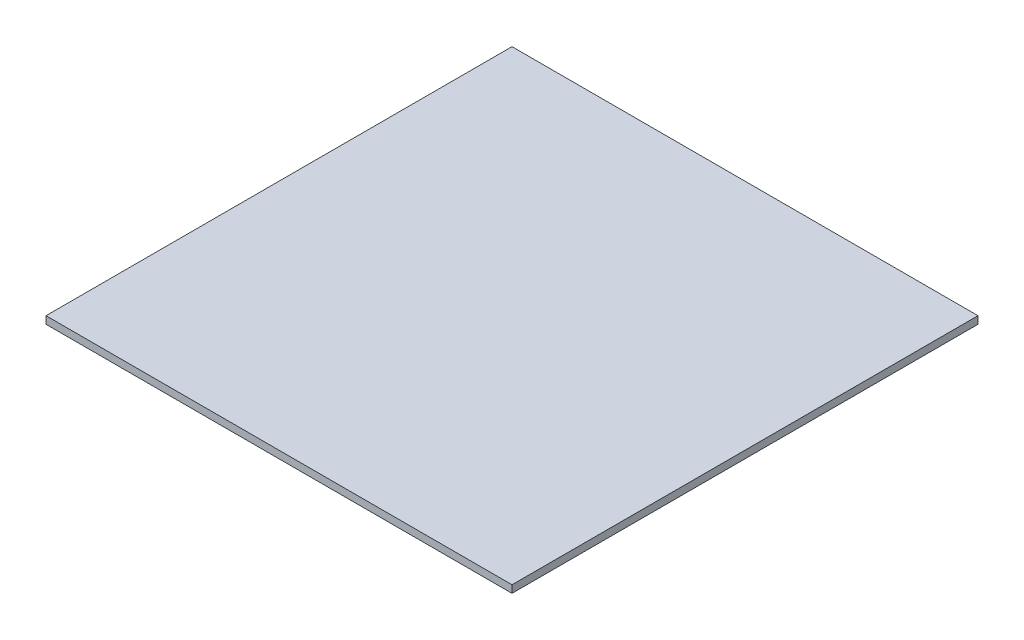
from build123d import *

# Parameters (mm, degrees)
SKETCH_1_W      = 250
SKETCH_1_H      = 250
EXTRUDE_1_DEPTH = 4


with BuildPart() as part:
    # Эскиз1 → Бобышка-Вытянуть1 (new body)
    with BuildSketch(Plane(origin=(0, 0, 0), x_dir=(1, 0, 0), z_dir=(0, 1, 0))):
        with Locations((125, 125)):
            Rectangle(SKETCH_1_W, SKETCH_1_H)
    extrude(amount=EXTRUDE_1_DEPTH)


solid = part.part
